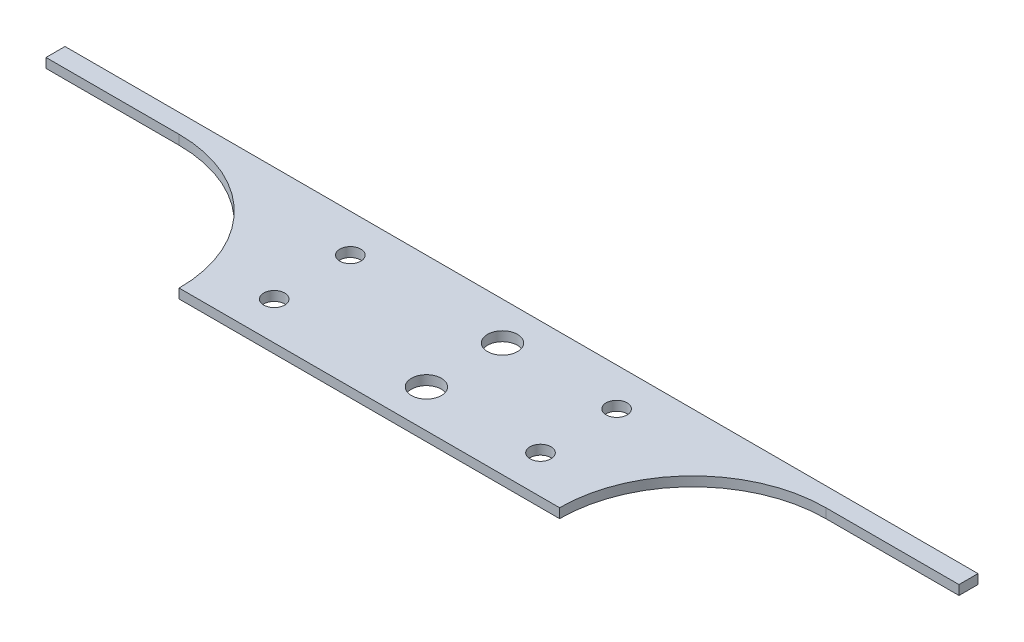
from build123d import *

# Parameters (mm, degrees)
SKETCH1_R           = 3.5
SKETCH1_R_2         = 5
BOSS_EXTRUDE1_DEPTH = 3.175


with BuildPart() as part:
    # Sketch1 → Boss-Extrude1 (new body)
    with BuildSketch(Plane(origin=(0, 0, 0), x_dir=(1, 0, 0), z_dir=(0, 1, 0))):
        with BuildLine():
            Line((-152.4, 19.05), (-107.95, 19.05))
            ThreePointArc((-107.95, 19.05), (-76.519103576, 6.030896424), (-63.5, -25.4))
            Line((-63.5, -25.4), (63.5, -25.4))
            ThreePointArc((63.5, -25.4), (76.519103576, 6.030896424), (107.95, 19.05))
            Line((107.95, 19.05), (152.4, 19.05))
            Line((152.4, 19.05), (152.4, 25.4))
            Line((152.4, 25.4), (-152.4, 25.4))
            Line((-152.4, 25.4), (-152.4, 19.05))
        make_face()
        with Locations((-44.45, -12.7)):
            Circle(SKETCH1_R, mode=Mode.SUBTRACT)
        with Locations((6.35, -12.7)):
            Circle(SKETCH1_R_2, mode=Mode.SUBTRACT)
        with Locations((44.45, -12.7)):
            Circle(SKETCH1_R, mode=Mode.SUBTRACT)
        with Locations((-44.45, 12.7)):
            Circle(SKETCH1_R, mode=Mode.SUBTRACT)
        with Locations((6.35, 12.7)):
            Circle(SKETCH1_R_2, mode=Mode.SUBTRACT)
        with Locations((44.45, 12.7)):
            Circle(SKETCH1_R, mode=Mode.SUBTRACT)
    extrude(amount=BOSS_EXTRUDE1_DEPTH)


solid = part.part
